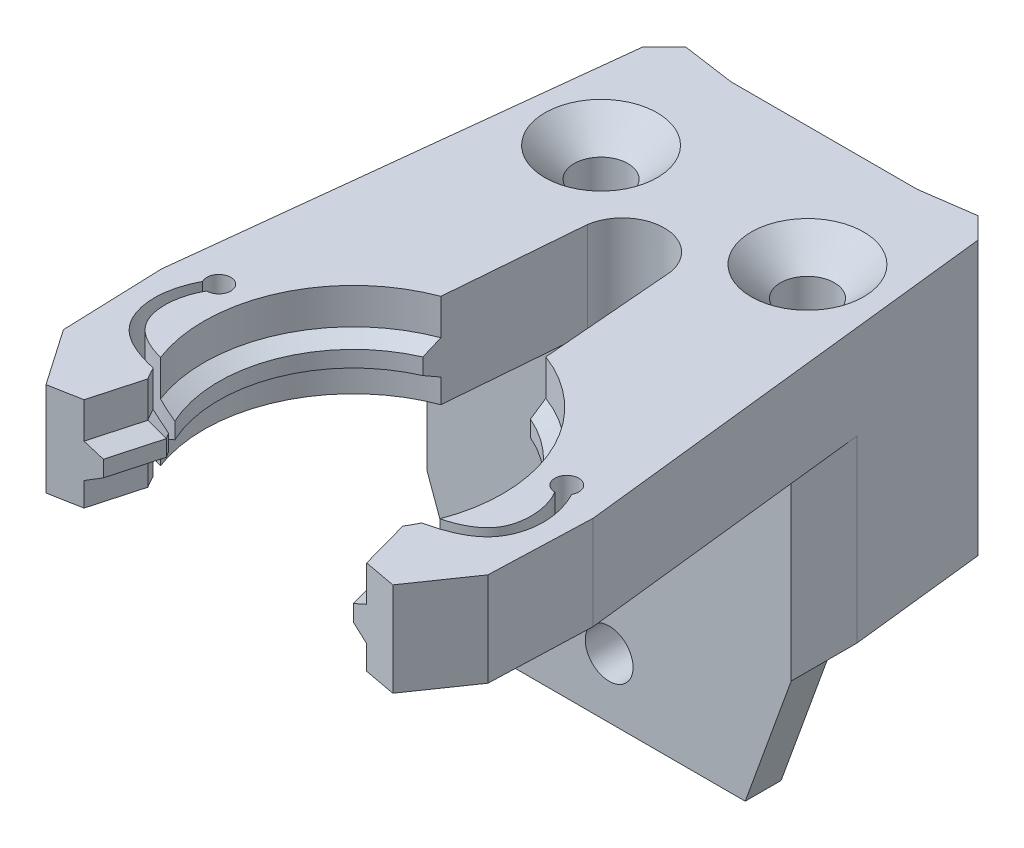
from build123d import *
from OCP.BRepFilletAPI import BRepFilletAPI_MakeChamfer

# Parameters (mm, degrees)
EXTRUDE_1_DEPTH                                 = 15.7
CUT_EXTRUDE_5_DEPTH                             = 6
CUT_EXTRUDE_START                               = -4
CUT_EXTRUDE_6_DEPTH                             = 4
CHAMFER_2_SIZE                                  = 2.5
CHAMFER_2_SIZE_2                                = 1.5
CHAMFER_3_SIZE                                  = 2.5
CHAMFER_3_SIZE_2                                = 1.5
CHAMFER_4_SIZE                                  = 2.5
CHAMFER_4_SIZE_2                                = 1.5
CHAMFER_5_SIZE                                  = 1.5
CHAMFER_5_SIZE_2                                = 2.5
CUT_EXTRUDE_7_DEPTH                             = 20
SCALE1_SCALE                                    = 0.5
BOSS_EXTRUDE2_DEPTH                             = 15
CSK_FOR_M4_FLAT_HEAD_MACHINE_SCREW1_D           = 4.5
CSK_FOR_M4_FLAT_HEAD_MACHINE_SCREW1_DEPTH       = 28.648063607
CSK_FOR_M4_FLAT_HEAD_MACHINE_SCREW1_CSINK_D     = 9.4
CSK_FOR_M4_FLAT_HEAD_MACHINE_SCREW1_CSINK_ANGLE = 90
CSK_FOR_M4_FLAT_HEAD_MACHINE_SCREW1_TIP         = 1.351936393
BOSS_EXTRUDE3_DEPTH                             = 3
BOSS_EXTRUDE3_DEPTH_BACK                        = 2.50573
CUT_EXTRUDE1_DEPTH                              = 79.961726409
CUT_EXTRUDE2_DEPTH                              = 5
CHAMFER1_START                                  = -1.425343225
CHAMFER1_DEPTH                                  = 0.342542044
CHAMFER1_START_2                                = -6.082801281
CHAMFER1_2_DEPTH                                = 4.657458056
CHAMFER1_START_3                                = 17
CHAMFER1_3_DEPTH                                = 3.923043383
CUT_EXTRUDE3_REACH                              = 62.423
SKETCH9_R                                       = 2


with BuildPart() as part:
    # Эскиз1 → Бобышка-Вытянуть1 (new body)
    with BuildSketch(Plane(origin=(0, 0, 0), x_dir=(1, 0, 0), z_dir=(0, 1, 0))):
        with BuildLine():
            Line((19, -55.842875467), (21.087010541, -30.364203971))
            ThreePointArc((21.087010541, -30.364203971), (28, -24.464466094), (34.912989459, -30.364203971))
            Line((34.912989459, -30.364203971), (37, -55.842875467))
            ThreePointArc((37, -55.842875467), (49.615065571, -70.216351148), (46.614482007, -89.103732671))
            Line((46.614482007, -89.103732671), (48.9, -97.364070254))
            Line((48.9, -97.364070254), (57, -98.864070254))
            Line((57, -98.864070254), (63.5, -89.453874559))
            Line((63.5, -89.453874559), (64.1, -72.464466094))
            Line((64.1, -72.464466094), (56, 0))
            Line((56, 0), (52.464466094, 3.535533906))
            Line((52.464466094, 3.535533906), (43.553055011, 2.275870258))
            Line((43.553055011, 2.275870258), (12.446944989, 2.275870258))
            Line((12.446944989, 2.275870258), (3.535533906, 3.535533906))
            Line((3.535533906, 3.535533906), (0, 0))
            Line((0, 0), (-8.1, -72.464466094))
            Line((-8.1, -72.464466094), (-7.5, -89.453874559))
            Line((-7.5, -89.453874559), (-1, -98.864070254))
            Line((-1, -98.864070254), (7.1, -97.364070254))
            Line((7.1, -97.364070254), (9.385517993, -89.103732671))
            ThreePointArc((9.385517993, -89.103732671), (6.384934429, -70.216351148), (19, -55.842875467))
        make_face()
    extrude(amount=EXTRUDE_1_DEPTH)

    # Эскиз9 → Вырез-Вытянуть5 (cut)
    with BuildSketch(Plane(origin=(0, 15.7, 0), x_dir=(1, 0, 0), z_dir=(0, 1, 0))):
        with BuildLine():
            Line((4.070420212, -98.938601985), (6.67745221, -89.516245887))
            ThreePointArc((6.67745221, -89.516245887), (28, -51.464466094), (49.32254779, -89.516245887))
            Line((49.32254779, -89.516245887), (51.928879153, -98.936069744))
            Line((51.928879153, -98.936069744), (4.070420212, -98.938601985))
        make_face()
    extrude(amount=-CUT_EXTRUDE_5_DEPTH, mode=Mode.SUBTRACT)

    # Эскиз10 → Вырез-Вытянуть6 (cut)
    with BuildSketch(Plane.XZ.offset(CUT_EXTRUDE_START)):
        with BuildLine():
            Line((49.32254779, 89.516245887), (52.714892846, 101.77688678))
            Line((52.714892846, 101.77688678), (2.982429051, 102.870828422))
            Line((2.982429051, 102.870828422), (6.67745221, 89.516245887))
            ThreePointArc((6.67745221, 89.516245887), (28, 51.464466094), (49.32254779, 89.516245887))
        make_face()
    extrude(amount=CUT_EXTRUDE_6_DEPTH, mode=Mode.SUBTRACT)

    # Фаска2
    chamfer_2_edges_1 = [part.edges().sort_by_distance(p)[0] for p in [
        (8.242758997, 9.7, 93.233901463),
    ]]
    chamfer_2_side_1 = [part.faces().sort_by_distance(p)[0] for p in [
        (8.213845332, 9.7, 93.225901463),
    ]]
    chamfer_2_edges_2 = [part.edges().sort_by_distance(p)[0] for p in [
        (6.384934429, 9.7, 70.216351148),
    ]]
    chamfer_2_side_2 = [part.faces().sort_by_distance(p)[0] for p in [
        (6.356114342, 9.7, 70.208020328),
    ]]
    chamfer_2 = BRepFilletAPI_MakeChamfer(part.part.solid().wrapped)
    for e in chamfer_2_edges_1:
        chamfer_2.Add(CHAMFER_2_SIZE - 0.0001, CHAMFER_2_SIZE_2 - 0.0001, e.wrapped, chamfer_2_side_1[0].wrapped)
    for e in chamfer_2_edges_2:
        chamfer_2.Add(CHAMFER_2_SIZE - 0.0001, CHAMFER_2_SIZE_2 - 0.0001, e.wrapped, chamfer_2_side_2[0].wrapped)
    add(Compound.cast(chamfer_2.Shape()), mode=Mode.REPLACE)  # a hair under: the kernel refuses the full size

    # Фаска3
    chamfer_3_edges_1 = [part.edges().sort_by_distance(p)[0] for p in [
        (8.242758997, 4, 93.233901463),
    ]]
    chamfer_3_side_1 = [part.faces().sort_by_distance(p)[0] for p in [
        (8.213845332, 4, 93.225901463),
    ]]
    chamfer_3_edges_2 = [part.edges().sort_by_distance(p)[0] for p in [
        (6.384934429, 4, 70.216351148),
    ]]
    chamfer_3_side_2 = [part.faces().sort_by_distance(p)[0] for p in [
        (6.384934429, 4.03, 70.216351148),
    ]]
    chamfer_3 = BRepFilletAPI_MakeChamfer(part.part.solid().wrapped)
    for e in chamfer_3_edges_1:
        chamfer_3.Add(CHAMFER_3_SIZE - 0.0001, CHAMFER_3_SIZE_2 - 0.0001, e.wrapped, chamfer_3_side_1[0].wrapped)
    for e in chamfer_3_edges_2:
        chamfer_3.Add(CHAMFER_3_SIZE_2 - 0.0001, CHAMFER_3_SIZE - 0.0001, e.wrapped, chamfer_3_side_2[0].wrapped)
    add(Compound.cast(chamfer_3.Shape()), mode=Mode.REPLACE)  # a hair under: the kernel refuses the full size

    # Фаска4
    chamfer_4_edges_1 = [part.edges().sort_by_distance(p)[0] for p in [
        (47.757241003, 9.7, 93.233901463),
    ]]
    chamfer_4_side_1 = [part.faces().sort_by_distance(p)[0] for p in [
        (47.786154668, 9.7, 93.225901463),
    ]]
    chamfer_4_edges_2 = [part.edges().sort_by_distance(p)[0] for p in [
        (49.615065571, 9.7, 70.216351148),
    ]]
    chamfer_4_side_2 = [part.faces().sort_by_distance(p)[0] for p in [
        (49.643885658, 9.7, 70.208020328),
    ]]
    chamfer_4 = BRepFilletAPI_MakeChamfer(part.part.solid().wrapped)
    for e in chamfer_4_edges_1:
        chamfer_4.Add(CHAMFER_4_SIZE - 0.0001, CHAMFER_4_SIZE_2 - 0.0001, e.wrapped, chamfer_4_side_1[0].wrapped)
    for e in chamfer_4_edges_2:
        chamfer_4.Add(CHAMFER_4_SIZE - 0.0001, CHAMFER_4_SIZE_2 - 0.0001, e.wrapped, chamfer_4_side_2[0].wrapped)
    add(Compound.cast(chamfer_4.Shape()), mode=Mode.REPLACE)  # a hair under: the kernel refuses the full size

    # Фаска5
    chamfer_5_edges_1 = [part.edges().sort_by_distance(p)[0] for p in [
        (47.757241003, 4, 93.233901463),
    ]]
    chamfer_5_side_1 = [part.faces().sort_by_distance(p)[0] for p in [
        (47.757241003, 4.03, 93.233901463),
    ]]
    chamfer_5_edges_2 = [part.edges().sort_by_distance(p)[0] for p in [
        (49.615065571, 4, 70.216351148),
    ]]
    chamfer_5_side_2 = [part.faces().sort_by_distance(p)[0] for p in [
        (49.643885658, 4, 70.208020328),
    ]]
    chamfer_5 = BRepFilletAPI_MakeChamfer(part.part.solid().wrapped)
    for e in chamfer_5_edges_1:
        chamfer_5.Add(CHAMFER_5_SIZE - 0.0001, CHAMFER_5_SIZE_2 - 0.0001, e.wrapped, chamfer_5_side_1[0].wrapped)
    for e in chamfer_5_edges_2:
        chamfer_5.Add(CHAMFER_5_SIZE_2 - 0.0001, CHAMFER_5_SIZE - 0.0001, e.wrapped, chamfer_5_side_2[0].wrapped)
    add(Compound.cast(chamfer_5.Shape()), mode=Mode.REPLACE)  # a hair under: the kernel refuses the full size

    # Эскиз11 → Вырез-Вытянуть7 (cut)
    with BuildSketch(Plane(origin=(0, 15.7, 0), x_dir=(1, 0, 0), z_dir=(0, 1, 0))):
        with BuildLine():
            Line((46.426049473, -86.017959352), (46.012822205, -88.379258027))
            add(Edge.make_bspline(
                [(58.862726543, -70.808948625), (60.119619749, -73.228227212), (61.202001727, -77.673197621), (57.883666669, -86.609034293), (49.905997231, -87.608281842), (46.012822205, -88.379258027)],
                knots=[0, 0, 0, 0, 0.305163468, 0.487677304, 1, 1, 1, 1], degree=3))
            ThreePointArc((58.862726543, -70.808948625), (56.072808864, -68.148005462), (57.1, -71.864070254))
            add(Edge.make_bspline(
                [(57.1, -71.864070254), (58.73856603, -74.489449168), (59.890065943, -84.15910166), (49.798382886, -85.957388163), (46.426049473, -86.017959352)],
                knots=[0, 0, 0, 0, 0.454203244, 1, 1, 1, 1], degree=3))
        make_face()
        with BuildLine():
            Line((9.573950527, -86.017959352), (9.987177795, -88.379258027))
            add(Edge.make_bspline(
                [(-2.862726543, -70.808948625), (-4.119619749, -73.228227212), (-5.202001727, -77.673197621), (-1.883666669, -86.609034293), (6.094002769, -87.608281842), (9.987177795, -88.379258027)],
                knots=[0, 0, 0, 0, 0.305163468, 0.487677304, 1, 1, 1, 1], degree=3))
            ThreePointArc((-2.862726543, -70.808948625), (-0.072808864, -68.148005462), (-1.1, -71.864070254))
            add(Edge.make_bspline(
                [(-1.1, -71.864070254), (-2.73856603, -74.489449168), (-3.890065943, -84.15910166), (6.201617114, -85.957388163), (9.573950527, -86.017959352)],
                knots=[0, 0, 0, 0, 0.454203244, 1, 1, 1, 1], degree=3))
        make_face()
    extrude(amount=-CUT_EXTRUDE_7_DEPTH, mode=Mode.SUBTRACT)


with BuildPart() as part_1:
    # Scale1: scaled about (27.999999844, 7.834407948, 37.565488007)
    add(part.part.scale(SCALE1_SCALE).moved(Location((13.999999922, 3.917203974, 18.782744003))))


with BuildPart() as boss_extrude2_tool:
    # Sketch5 → Boss-Extrude2 (new body)
    with BuildSketch(Plane.XZ.offset(-3.917198819)):
        Polygon((15.767885362, 17.014994944), (14.000118409, 18.782761897), (12.822450363, 29.318451551), (12.727631466, 30.166723248), (28.000118409, 31.014994944), (43.272605352, 30.166723248), (42.000118409, 18.782761897), (40.232351456, 17.014994944), (35.776645915, 17.644826768), (20.223590904, 17.644826768), align=None)
    extrude(amount=BOSS_EXTRUDE2_DEPTH)


with BuildPart() as part_2:
    add(part_1.part)


with BuildPart() as part_3:
    # Boss-Extrude2: joined with boss_extrude2_tool
    add(part_2.part.fuse(boss_extrude2_tool.part, tol=0.00001))

    # CSK for M4 Flat Head Machine Screw1
    with Locations(Plane(origin=(19.370167772, 11.767198819, 27.6724529), x_dir=(0, 0, 1), z_dir=(0, 1, 0))):
        with Locations((0, 0), (0, 17.26)):
            CounterSinkHole(CSK_FOR_M4_FLAT_HEAD_MACHINE_SCREW1_D / 2, CSK_FOR_M4_FLAT_HEAD_MACHINE_SCREW1_CSINK_D / 2, depth=CSK_FOR_M4_FLAT_HEAD_MACHINE_SCREW1_DEPTH, counter_sink_angle=CSK_FOR_M4_FLAT_HEAD_MACHINE_SCREW1_CSINK_ANGLE)
            with Locations((0, 0, -(CSK_FOR_M4_FLAT_HEAD_MACHINE_SCREW1_DEPTH + CSK_FOR_M4_FLAT_HEAD_MACHINE_SCREW1_TIP / 2))):  # 118° drill point
                Cone(0, CSK_FOR_M4_FLAT_HEAD_MACHINE_SCREW1_D / 2, CSK_FOR_M4_FLAT_HEAD_MACHINE_SCREW1_TIP, mode=Mode.SUBTRACT)


with BuildPart() as boss_extrude3_tool:
    # Sketch6 → Boss-Extrude3 (new, two sides: drawn at the far end of the back side and taken through both)
    with BuildSketch(Plane.XY.offset(32.6724529).offset(-BOSS_EXTRUDE3_DEPTH_BACK)):
        Polygon((12.822450363, -11.082801181), (12.822450363, 3.917198819), (43.272605352, 3.917198819), (43.272605352, -11.082801181), (39.425133125, -21.709493147), (16.66992259, -21.709493147), align=None)
    extrude(amount=BOSS_EXTRUDE3_DEPTH + BOSS_EXTRUDE3_DEPTH_BACK)


with BuildPart() as part_4:
    add(part_3.part)


with BuildPart() as part_5:
    # Boss-Extrude3: joined with boss_extrude3_tool
    add(part_4.part.fuse(boss_extrude3_tool.part, tol=0.00001))

    # Sketch7 → Cut-Extrude1 (cut, through all)
    with BuildSketch(Plane(origin=(43.272605352, 0, 0), x_dir=(0, 0, -1), z_dir=(1, 0, 0))):
        Polygon((-32.6724529, -22.263045792), (-32.6724529, -12.082801181), (-32.6724529, -11.082801181), (-31.6724529, -11.082801181), (-27.1724529, -11.082801181), (-27.1724529, -22.263045792), align=None)
    extrude(amount=-CUT_EXTRUDE1_DEPTH, mode=Mode.SUBTRACT)

    # Sketch8 → Cut-Extrude2 (cut)
    with BuildSketch(Plane(origin=(0, 3.917198819, 0), x_dir=(1, 0, 0), z_dir=(0, 1, 0))):
        with BuildLine():
            Line((31.596485278, -35.6724529), (31.456613139, -33.964863882))
            ThreePointArc((31.456613139, -33.964863882), (28.000118409, -31.014994944), (24.54362368, -33.964863882))
            Line((24.54362368, -33.964863882), (24.403751541, -35.6724529))
            Line((24.403751541, -35.6724529), (31.596485278, -35.6724529))
        make_face()
    extrude(amount=-CUT_EXTRUDE2_DEPTH, mode=Mode.SUBTRACT)

    # Chamfer1: read off the stored shape, not the designer's step
    # Chamfer1 outline → Chamfer1 (cut)
    with BuildSketch(Plane(origin=(0, 0, 0), x_dir=(1, 0, 0), z_dir=(0, 1, 0)).offset(CHAMFER1_START)):
        with BuildLine():
            ThreePointArc((31.456613139, -33.964863882), (28.00011841, -31.014994944), (24.54362368, -33.964863882))
            Line((24.54362368, -33.964863882), (24.403751541, -35.6724529))
            Line((24.403751541, -35.6724529), (31.596485278, -35.6724529))
            Line((31.596485278, -35.6724529), (31.456613139, -33.964863882))
        make_face()
    extrude(amount=CHAMFER1_DEPTH, mode=Mode.SUBTRACT)

    # Chamfer1 2 outline → Chamfer1 2 (cut)
    with BuildSketch(Plane(origin=(0, 0, 0), x_dir=(1, 0, 0), z_dir=(0, 1, 0)).offset(CHAMFER1_START_2)):
        with BuildLine():
            ThreePointArc((31.456613139, -33.964863882), (28.00011841, -31.014994944), (24.54362368, -33.964863882))
            Line((24.54362368, -33.964863882), (24.403751541, -35.6724529))
            Line((24.403751541, -35.6724529), (31.596485278, -35.6724529))
            Line((31.596485278, -35.6724529), (31.456613139, -33.964863882))
        make_face()
    extrude(amount=CHAMFER1_2_DEPTH, mode=Mode.SUBTRACT)

    # Chamfer1 3 outline → Chamfer1 3 (add)
    with BuildSketch(Plane(origin=(0, 0, 0), x_dir=(1, 0, 0), z_dir=(0, 0.7071067811865511, 0.7071067811865441)).offset(CHAMFER1_START_3)):
        with BuildLine():
            add(Edge.make_bspline(
                [(24.54362368, -27.110527763), (25.013120861, -22.938783104), (28.000118409, -22.938783104), (30.987115958, -22.938783104), (31.456613139, -27.110527763)],
                knots=[1.72863114, 1.72863114, 1.72863114, 3.141592654, 3.141592654, 4.554554167, 4.554554167, 4.554554167], degree=2, weights=[1, 0.760651137, 1, 0.760651137, 1]))
            Line((24.54362368, -27.110527763), (24.403751541, -29.525423311))
            Line((24.403751541, -29.525423311), (31.596485278, -29.525423311))
            Line((31.596485278, -29.525423311), (31.456613139, -27.110527763))
        make_face()
    extrude(amount=CHAMFER1_3_DEPTH)

    # Sketch9 → Cut-Extrude3 (cut, up to next)
    with BuildSketch(Plane.XY.offset(35.6724529), mode=Mode.PRIVATE) as cut_extrude3_sk1:
        with Locations((28.047527858, -16.709493147)):
            Circle(SKETCH9_R)
    cut_extrude3_tool1 = extrude(cut_extrude3_sk1.sketch, amount=-CUT_EXTRUDE3_REACH, mode=Mode.PRIVATE) & part_5.part
    add(cut_extrude3_tool1.solids().sort_by_distance((28.047528, -16.709493, 35.672453))[0], mode=Mode.SUBTRACT)


solid = part_5.part
